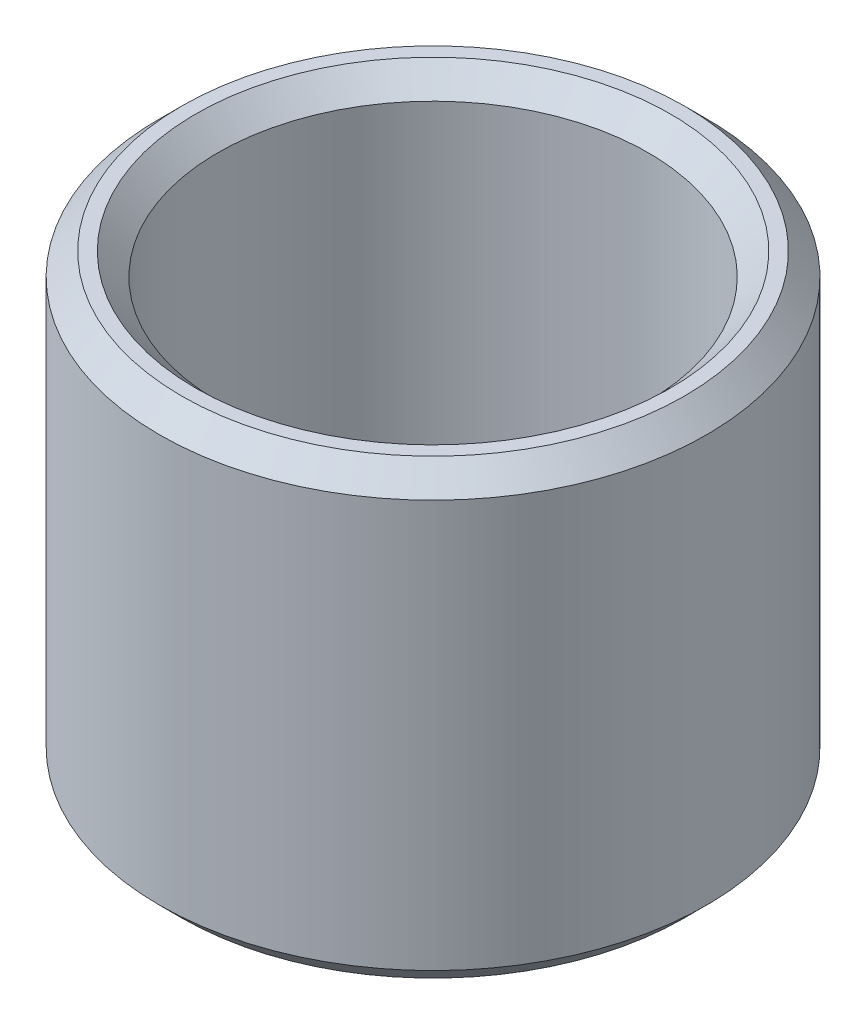
from build123d import *

# Parameters (mm, degrees)
SKETCH1_R           = 40
BOSS_EXTRUDE1_DEPTH = 66.076533133
SKETCH2_R           = 31.447573561
CUT_EXTRUDE1_DEPTH  = 87.983379049
CHAMFER1_SIZE       = 3.261910285


with BuildPart() as part:
    # Sketch1 → Boss-Extrude1 (new body)
    with BuildSketch(Plane(origin=(0, 0, 0), x_dir=(1, 0, 0), z_dir=(0, 1, 0))):
        Circle(SKETCH1_R)
    extrude(amount=BOSS_EXTRUDE1_DEPTH)

    # Sketch2 → Cut-Extrude1 (cut, through all)
    with BuildSketch(Plane(origin=(0, 0, 0), x_dir=(1, 0, 0), z_dir=(0, 1, 0))):
        Circle(SKETCH2_R)
    extrude(amount=CUT_EXTRUDE1_DEPTH, mode=Mode.SUBTRACT)

    # Chamfer1
    chamfer1_edges = [part.edges().sort_by_distance(p)[0] for p in [
        (-31.447573561, 66.076533133, 0),
        (-31.447573561, 0, 0),
        (-40, 0, 0),
        (-40, 66.076533133, 0),
    ]]
    chamfer(chamfer1_edges, length=CHAMFER1_SIZE)


solid = part.part
